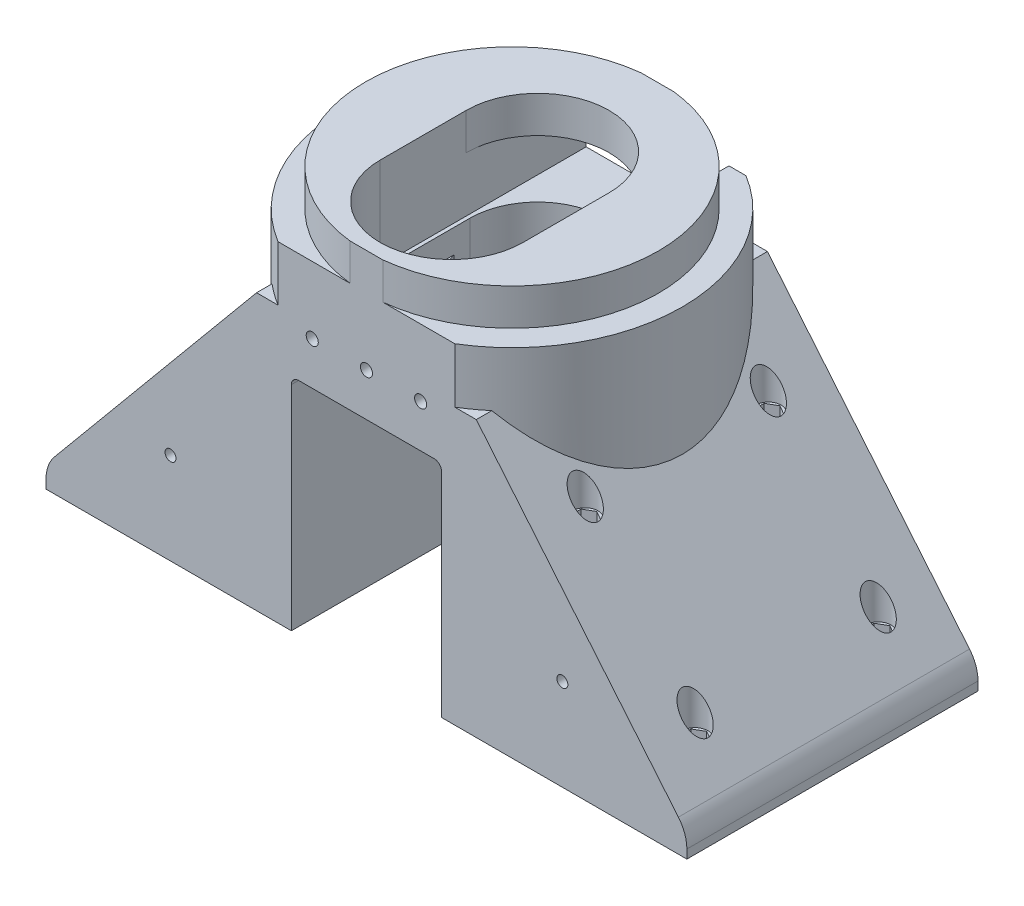
from build123d import *

# Parameters (mm, degrees)
BOSS_EXTRUDE2_START   = -32.75
BOSS_EXTRUDE2_DEPTH   = 79.5
CUT_EXTRUDE1_DEPTH    = 117.042459902
SKETCH6_R             = 1.7
CUT_EXTRUDE2_DEPTH    = 125.486354674
CUT_EXTRUDE3_START    = -3
CUT_EXTRUDE3_DEPTH    = 122.486354674
CUT_EXTRUDE8_START    = -15
SKETCH17_R            = 3.5
CUT_EXTRUDE8_DEPTH    = 110.486354674
CUT_EXTRUDE9_START    = -52
SKETCH18_R            = 3.5
CUT_EXTRUDE9_DEPTH    = 73.486354674
FILLET1_R             = 2
FILLET3_R             = 10
CUT_EXTRUDE5_REACH    = 142.113
SKETCH10_R            = 1.65
CUT_EXTRUDE6_REACH    = 142.113
SKETCH11_R            = 1.5
BOSS_EXTRUDE4_DEPTH   = 8.5
BOSS_EXTRUDE5_START   = -66.421548224
BOSS_EXTRUDE5_DEPTH   = 81.421548224
BOSS_EXTRUDE5_2_DEPTH = 15
BOSS_EXTRUDE6_DEPTH   = 10


with BuildPart() as part:
    # Sketch3 → Boss-Extrude2 (new body)
    with BuildSketch(Plane.XY.offset(BOSS_EXTRUDE2_START)):
        Polygon((-20.5, 0), (-87.5, 0), (-87.5, 6), (-30, 75.2), (0, 75.2), (0, 60.2), (-20.5, 60.2), align=None)
    boss_extrude2 = extrude(amount=BOSS_EXTRUDE2_DEPTH)

    # Mirror1: Boss-Extrude2 across plane
    add(boss_extrude2.mirror(Plane(origin=(0, 75.2, -32.75), x_dir=(0, 0, 1), z_dir=(1, 0, 0))))

    # Sketch4 → Cut-Extrude1 (cut, through all)
    with BuildSketch(Plane.XZ.offset(-60.2)):
        with BuildLine():
            Line((-18.5, 0), (-18.5, 18.5))
            Line((-18.5, 18.5), (18.5, 18.5))
            Line((18.5, 18.5), (18.5, 0))
            ThreePointArc((18.5, 0), (0, -18.5), (-18.5, 0))
        make_face()
    extrude(amount=-CUT_EXTRUDE1_DEPTH, mode=Mode.SUBTRACT)

    # Sketch6 → Cut-Extrude2 (cut, through all)
    with BuildSketch(Plane.XZ):
        with Locations((-75, 32)):
            Circle(SKETCH6_R)
        with Locations((-75, -18)):
            Circle(SKETCH6_R)
        with Locations((75, 32)):
            Circle(SKETCH6_R)
        with Locations((75, -18)):
            Circle(SKETCH6_R)
        with Locations((-45, 32)):
            Circle(SKETCH6_R)
        with Locations((-45, -18)):
            Circle(SKETCH6_R)
        with Locations((45, 32)):
            Circle(SKETCH6_R)
        with Locations((45, -18)):
            Circle(SKETCH6_R)
    extrude(amount=-CUT_EXTRUDE2_DEPTH, mode=Mode.SUBTRACT)

    # Sketch7 → Cut-Extrude3 (cut, through all)
    with BuildSketch(Plane.XZ.offset(CUT_EXTRUDE3_START)):
        Polygon((-75, 35.175426481), (-77.75, 33.58771324), (-77.75, 30.41228676), (-75, 28.824573519), (-72.25, 30.41228676), (-72.25, 33.58771324), align=None)
        Polygon((-75, -14.824573519), (-77.75, -16.41228676), (-77.75, -19.58771324), (-75, -21.175426481), (-72.25, -19.58771324), (-72.25, -16.41228676), align=None)
        Polygon((-45, -14.824573519), (-47.75, -16.41228676), (-47.75, -19.58771324), (-45, -21.175426481), (-42.25, -19.58771324), (-42.25, -16.41228676), align=None)
        Polygon((-45, 35.175426481), (-47.75, 33.58771324), (-47.75, 30.41228676), (-45, 28.824573519), (-42.25, 30.41228676), (-42.25, 33.58771324), align=None)
        Polygon((45, -14.824573519), (42.25, -16.41228676), (42.25, -19.58771324), (45, -21.175426481), (47.75, -19.58771324), (47.75, -16.41228676), align=None)
        Polygon((75, -14.824573519), (72.25, -16.41228676), (72.25, -19.58771324), (75, -21.175426481), (77.75, -19.58771324), (77.75, -16.41228676), align=None)
        Polygon((75, 35.175426481), (72.25, 33.58771324), (72.25, 30.41228676), (75, 28.824573519), (77.75, 30.41228676), (77.75, 33.58771324), align=None)
        Polygon((45, 35.175426481), (42.25, 33.58771324), (42.25, 30.41228676), (45, 28.824573519), (47.75, 30.41228676), (47.75, 33.58771324), align=None)
    extrude(amount=-CUT_EXTRUDE3_DEPTH, mode=Mode.SUBTRACT)

    # Sketch17 → Cut-Extrude8 (cut, through all)
    with BuildSketch(Plane.XZ.offset(CUT_EXTRUDE8_START)):
        with Locations((-75, 32)):
            Circle(SKETCH17_R)
        with Locations((-75, -18)):
            Circle(SKETCH17_R)
        with Locations((75, 32)):
            Circle(SKETCH17_R)
        with Locations((75, -18)):
            Circle(SKETCH17_R)
    extrude(amount=-CUT_EXTRUDE8_DEPTH, mode=Mode.SUBTRACT)

    # Sketch18 → Cut-Extrude9 (cut, through all)
    with BuildSketch(Plane.XZ.offset(CUT_EXTRUDE9_START)):
        with Locations((-45, 32)):
            Circle(SKETCH18_R)
        with Locations((-45, -18)):
            Circle(SKETCH18_R)
        with Locations((45, -18)):
            Circle(SKETCH18_R)
        with Locations((45, 32)):
            Circle(SKETCH18_R)
    extrude(amount=-CUT_EXTRUDE9_DEPTH, mode=Mode.SUBTRACT)

    # Fillet1
    fillet1_edges = [part.edges().sort_by_distance(p)[0] for p in [
        (-20.5, 60.2, 7),
        (20.5, 60.2, 7),
    ]]
    fillet(fillet1_edges, radius=FILLET1_R - 0.0001)  # a hair under: the kernel refuses the full size

    # Fillet3
    fillet3_edges = [part.edges().sort_by_distance(p)[0] for p in [
        (-87.5, 6, 7),
        (87.5, 6, 7),
    ]]
    fillet(fillet3_edges, radius=FILLET3_R)

    # Sketch10 → Cut-Extrude5 (cut, up to next)
    with BuildSketch(Plane.XY.offset(46.75), mode=Mode.PRIVATE) as cut_extrude5_sk1:
        with Locations((0, 71.9)):
            Circle(SKETCH10_R)
    cut_extrude5_tool1 = extrude(cut_extrude5_sk1.sketch, amount=-CUT_EXTRUDE5_REACH, mode=Mode.PRIVATE) & part.part
    # Sketch10 → Cut-Extrude5 (cut, up to next)
    with BuildSketch(Plane.XY.offset(46.75), mode=Mode.PRIVATE) as cut_extrude5_sk2:
        with Locations((-14.8, 71.9)):
            Circle(SKETCH10_R)
    cut_extrude5_tool2 = extrude(cut_extrude5_sk2.sketch, amount=-CUT_EXTRUDE5_REACH, mode=Mode.PRIVATE) & part.part
    # Sketch10 → Cut-Extrude5 (cut, up to next)
    with BuildSketch(Plane.XY.offset(46.75), mode=Mode.PRIVATE) as cut_extrude5_sk3:
        with Locations((14.8, 71.9)):
            Circle(SKETCH10_R)
    cut_extrude5_tool3 = extrude(cut_extrude5_sk3.sketch, amount=-CUT_EXTRUDE5_REACH, mode=Mode.PRIVATE) & part.part
    add(cut_extrude5_tool1.solids().sort_by_distance((0, 71.9, 46.75))[0], mode=Mode.SUBTRACT)
    add(cut_extrude5_tool2.solids().sort_by_distance((-14.8, 71.9, 46.75))[0], mode=Mode.SUBTRACT)
    add(cut_extrude5_tool3.solids().sort_by_distance((14.8, 71.9, 46.75))[0], mode=Mode.SUBTRACT)

    # Sketch11 → Cut-Extrude6 (cut, up to next)
    with BuildSketch(Plane.XY.offset(46.75), mode=Mode.PRIVATE) as cut_extrude6_sk1:
        with Locations((-53.5, 25)):
            Circle(SKETCH11_R)
    cut_extrude6_tool1 = extrude(cut_extrude6_sk1.sketch, amount=-CUT_EXTRUDE6_REACH, mode=Mode.PRIVATE) & part.part
    # Sketch11 → Cut-Extrude6 (cut, up to next)
    with BuildSketch(Plane.XY.offset(46.75), mode=Mode.PRIVATE) as cut_extrude6_sk2:
        with Locations((53.5, 25)):
            Circle(SKETCH11_R)
    cut_extrude6_tool2 = extrude(cut_extrude6_sk2.sketch, amount=-CUT_EXTRUDE6_REACH, mode=Mode.PRIVATE) & part.part
    add(cut_extrude6_tool1.solids().sort_by_distance((-53.5, 25, 46.75))[0], mode=Mode.SUBTRACT)
    add(cut_extrude6_tool2.solids().sort_by_distance((53.5, 25, 46.75))[0], mode=Mode.SUBTRACT)

    # Sketch13 → Boss-Extrude4 (add)
    with BuildSketch(Plane.XZ.offset(-60.2)):
        with BuildLine():
            Line((-18.5, 18.5), (-18.5, 4.330127019))
            ThreePointArc((-18.5, 4.330127019), (-13.435028843, 13.435028843), (-4.330127019, 18.5))
            Line((-4.330127019, 18.5), (-18.5, 18.5))
        make_face()
        with BuildLine():
            Line((18.5, 18.5), (4.330127019, 18.5))
            ThreePointArc((4.330127019, 18.5), (13.435028843, 13.435028843), (18.5, 4.330127019))
            Line((18.5, 4.330127019), (18.5, 18.5))
        make_face()
    extrude(amount=-BOSS_EXTRUDE4_DEPTH)

    # Boss-Extrude5: read off the stored shape, not the designer's step
    # Boss-Extrude5 outline → Boss-Extrude5 (add)
    with BuildSketch(Plane(origin=(0, 75.2, 0), x_dir=(1, 0, 0), z_dir=(0, 1, 0)).offset(BOSS_EXTRUDE5_START)):
        with BuildLine():
            Line((-30, -42.528157847), (-30, 28.528157847))
            ThreePointArc((-30, 28.528157847), (-46.5, -7), (-30, -42.528157847))
        make_face()
        with BuildLine():
            ThreePointArc((30, -42.528157847), (46.5, -7), (30, 28.528157847))
            Line((30, 28.528157847), (30, -42.528157847))
        make_face()
    extrude(amount=BOSS_EXTRUDE5_DEPTH)

    # Boss-Extrude5 2 outline → Boss-Extrude5 2 (add)
    with BuildSketch(Plane(origin=(0, 75.2, 0), x_dir=(1, 0, 0), z_dir=(0, 1, 0))):
        with BuildLine():
            Line((-19.5, 32.75), (-24.128561913, 32.75))
            ThreePointArc((-24.128561913, 32.75), (-27.146478436, 30.753393338), (-30, 28.528157847))
            Line((-30, 28.528157847), (-30, -42.528157847))
            ThreePointArc((-30, -42.528157847), (-27.146478436, -44.753393338), (-24.128561913, -46.75))
            Line((-24.128561913, -46.75), (24.128561913, -46.75))
            ThreePointArc((24.128561913, -46.75), (27.146478436, -44.753393338), (30, -42.528157847))
            Line((30, -42.528157847), (30, 28.528157847))
            ThreePointArc((30, 28.528157847), (27.146478436, 30.753393338), (24.128561913, 32.75))
            Line((24.128561913, 32.75), (19.5, 32.75))
            Line((19.5, 32.75), (19.5, -23.5))
            ThreePointArc((19.5, -23.5), (0, -43), (-19.5, -23.5))
            Line((-19.5, -23.5), (-19.5, 32.75))
        make_face()
    extrude(amount=BOSS_EXTRUDE5_2_DEPTH)

    # Sketch15 → Boss-Extrude6 (add)
    with BuildSketch(Plane(origin=(0, 90.2, 0), x_dir=(1, 0, 0), z_dir=(0, 1, 0))):
        with BuildLine():
            Line((-4.465142775, 32.75), (4.465142775, 32.75))
            ThreePointArc((4.465142775, 32.75), (40, -7), (4.465142775, -46.75))
            Line((4.465142775, -46.75), (-4.465142775, -46.75))
            ThreePointArc((-4.465142775, -46.75), (-40, -7), (-4.465142775, 32.75))
        make_face()
        with BuildLine():
            Line((19.5, -23.5), (19.5, 0))
            ThreePointArc((19.5, 0), (0, 19.5), (-19.5, 0))
            Line((-19.5, 0), (-19.5, -23.5))
            ThreePointArc((-19.5, -23.5), (0, -43), (19.5, -23.5))
        make_face(mode=Mode.SUBTRACT)
    extrude(amount=BOSS_EXTRUDE6_DEPTH)


solid = part.part
